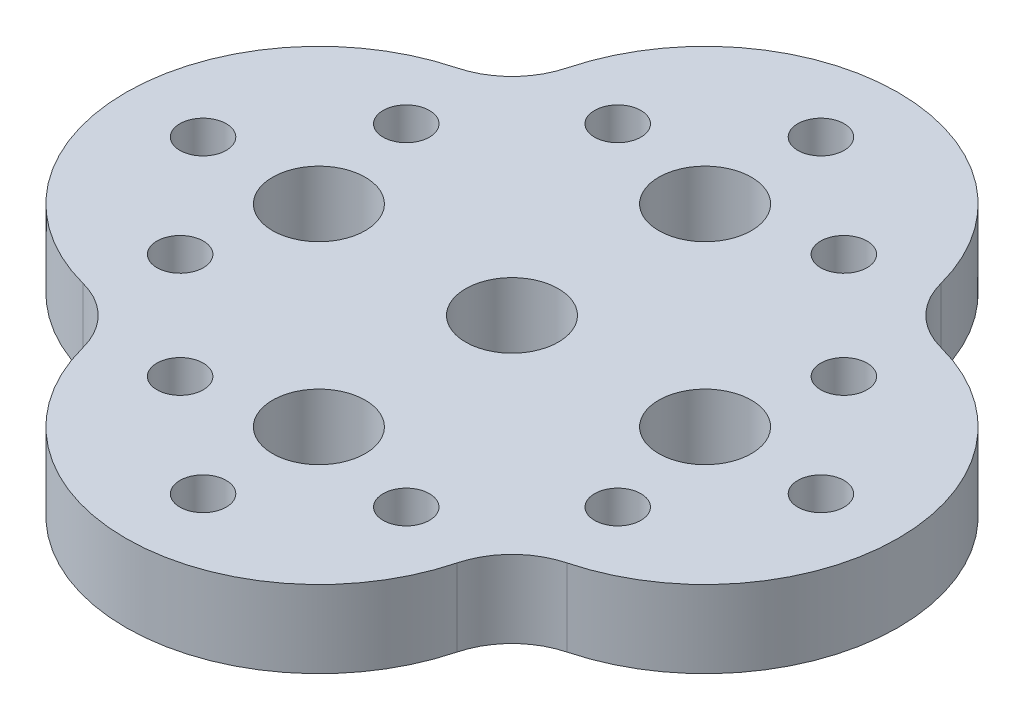
from build123d import *

# Parameters (mm, degrees)
SKETCH1_R             = 152.4
BOSS_EXTRUDE1_DEPTH   = 254
SKETCH2_R             = 76.2
CUT_EXTRUDE1_DEPTH    = 254
CRVPATTERN1_OUTLINE_R = 76.2
CRVPATTERN1_DEPTH     = 254


# Read off the part's stored shape, not the designer's step: CrvPattern1
with BuildPart() as part:
    # Sketch1 → Boss-Extrude1 (new body)
    with BuildSketch(Plane(origin=(0, 0, 0), x_dir=(1, 0, 0), z_dir=(0, 1, 0))):
        with BuildLine():
            ThreePointArc((613.94875478, 796.151297918), (-0.368557952, 1270.405413748), (-614.685870684, 796.151297918))
            ThreePointArc((-614.685870684, 796.151297918), (-680.807673358, 680.844529161), (-796.114442116, 614.722726489))
            ThreePointArc((-796.114442116, 614.722726489), (-1270.36855796, 0.40541375), (-796.114442121, -613.911898992))
            ThreePointArc((-796.114442121, -613.911898992), (-680.80767336, -680.033701667), (-614.685870683, -795.340470428))
            ThreePointArc((-614.685870683, -795.340470428), (-0.368557952, -1269.594586252), (613.948754778, -795.340470428))
            ThreePointArc((613.948754778, -795.340470428), (680.070557455, -680.033701667), (795.377326216, -613.911898992))
            ThreePointArc((795.377326216, -613.911898992), (1269.631442055, 0.40541375), (795.377326211, 614.722726489))
            ThreePointArc((795.377326211, 614.722726489), (680.070557454, 680.844529161), (613.94875478, 796.151297918))
        make_face()
        with Locations(Location((-0.368557952, 0.405413748, 0), (0, 0, 270))):
            Circle(SKETCH1_R, mode=Mode.SUBTRACT)
        with Locations(Location((-0.368557952, 635.405413748, 0), (0, 0, 270))):
            Circle(SKETCH1_R, mode=Mode.SUBTRACT)
        with Locations(Location((634.631442048, 0.405413748, 0), (0, 0, 270))):
            Circle(SKETCH1_R, mode=Mode.SUBTRACT)
        with Locations(Location((-0.368557952, -634.594586252, 0), (0, 0, 270))):
            Circle(SKETCH1_R, mode=Mode.SUBTRACT)
        with Locations(Location((-635.368557952, 0.405413748, 0), (0, 0, 270))):
            Circle(SKETCH1_R, mode=Mode.SUBTRACT)
    extrude(amount=BOSS_EXTRUDE1_DEPTH)

    # Sketch2 → Cut-Extrude1 (cut)
    with BuildSketch(Plane(origin=(0, 254, 0), x_dir=(1, 0, 0), z_dir=(0, 1, 0))):
        with Locations(Location((-0.368557952, -1015.594586252, 0), (0, 0, 270))):
            Circle(SKETCH2_R)
    extrude(amount=-CUT_EXTRUDE1_DEPTH, mode=Mode.SUBTRACT)

    # CrvPattern1 outline → CrvPattern1 (cut)
    with BuildSketch(Plane(origin=(0, 0, 0), x_dir=(1, 0, 0), z_dir=(0, 1, 0))):
        with Locations((371.486330055, -719.156943677)):
            Circle(CRVPATTERN1_OUTLINE_R)
        with Locations((-372.22344596, -719.156943677)):
            Circle(CRVPATTERN1_OUTLINE_R)
        with Locations((-719.930915389, -371.449474263)):
            Circle(CRVPATTERN1_OUTLINE_R)
        with Locations((-1016.36855796, 0.405413748)):
            Circle(CRVPATTERN1_OUTLINE_R)
        with Locations((-719.930915387, 372.260301759)):
            Circle(CRVPATTERN1_OUTLINE_R)
        with Locations((-372.22344596, 719.967771172)):
            Circle(CRVPATTERN1_OUTLINE_R)
        with Locations((-0.368557952, 1016.405413748)):
            Circle(CRVPATTERN1_OUTLINE_R)
        with Locations((371.486330055, 719.967771172)):
            Circle(CRVPATTERN1_OUTLINE_R)
        with Locations((719.193799482, 372.260301759)):
            Circle(CRVPATTERN1_OUTLINE_R)
        with Locations((1015.631442055, 0.405413748)):
            Circle(CRVPATTERN1_OUTLINE_R)
        with Locations((719.193799484, -371.449474263)):
            Circle(CRVPATTERN1_OUTLINE_R)
    extrude(amount=CRVPATTERN1_DEPTH, mode=Mode.SUBTRACT)


solid = part.part
